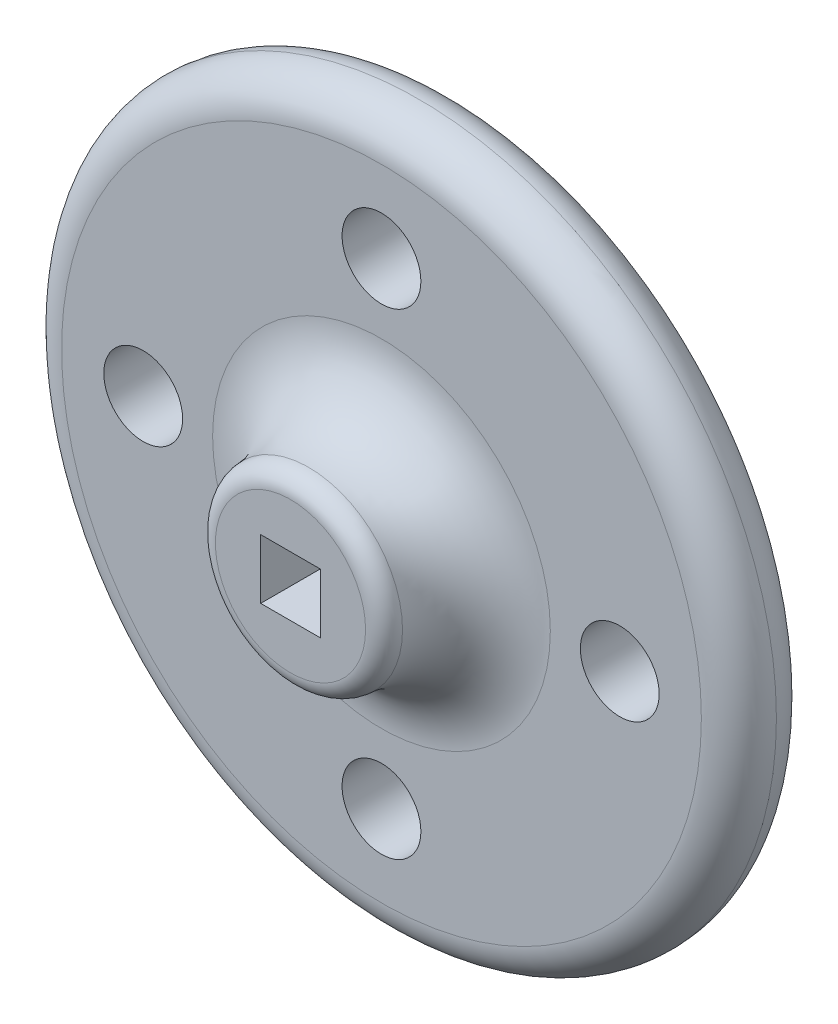
from build123d import *

# Parameters (mm, degrees)
SKETCH1_R           = 19.05
SKETCH1_R_2         = 5
SKETCH1_R_3         = 2.1
SKETCH1_W           = 3.175
SKETCH1_H           = 3.175
BOSS_EXTRUDE1_DEPTH = 4
BOSS_EXTRUDE2_START = 4
SKETCH1_3_R         = 5
SKETCH1_3_W         = 3.175
SKETCH1_3_H         = 3.175
BOSS_EXTRUDE2_DEPTH = 4.85
FILLET1_R           = 4
FILLET2_R           = 1
FILLET3_R           = 2


with BuildPart() as part:
    # Sketch1 → Boss-Extrude1 (new body)
    # profile 1 of 2: a face of its own
    with BuildSketch(Plane.XY):
        Circle(SKETCH1_R)
        Circle(SKETCH1_R_2, mode=Mode.SUBTRACT)
        with Locations((12.7, 0)):
            Circle(SKETCH1_R_3, mode=Mode.SUBTRACT)
        with Locations((0, -12.7)):
            Circle(SKETCH1_R_3, mode=Mode.SUBTRACT)
        with Locations((-12.7, 0)):
            Circle(SKETCH1_R_3, mode=Mode.SUBTRACT)
        with Locations((0, 12.7)):
            Circle(SKETCH1_R_3, mode=Mode.SUBTRACT)
    # profile 2 of 2: a face of its own
    with BuildSketch(Plane.XY):
        Circle(SKETCH1_R_2)
        Rectangle(SKETCH1_W, SKETCH1_H, mode=Mode.SUBTRACT)
    extrude(amount=BOSS_EXTRUDE1_DEPTH)

    # Sketch1<3> → Boss-Extrude2 (add)
    with BuildSketch(Plane.XY.offset(BOSS_EXTRUDE2_START)):
        Circle(SKETCH1_3_R)
        Rectangle(SKETCH1_3_W, SKETCH1_3_H, mode=Mode.SUBTRACT)
    extrude(amount=BOSS_EXTRUDE2_DEPTH)

    # Fillet1
    fillet1_edges = [part.edges().sort_by_distance(p)[0] for p in [
        (-5, 0, 4),
    ]]
    fillet(fillet1_edges, radius=FILLET1_R)

    # Fillet2
    fillet2_edges = [part.edges().sort_by_distance(p)[0] for p in [
        (-5, 0, 8.85),
    ]]
    fillet(fillet2_edges, radius=FILLET2_R)

    # Fillet3
    fillet3_edges = [part.edges().sort_by_distance(p)[0] for p in [
        (-19.05, 0, 0),
        (-19.05, 0, 4),
    ]]
    fillet(fillet3_edges, radius=FILLET3_R - 0.0001)  # a hair under: the kernel refuses the full size


solid = part.part
